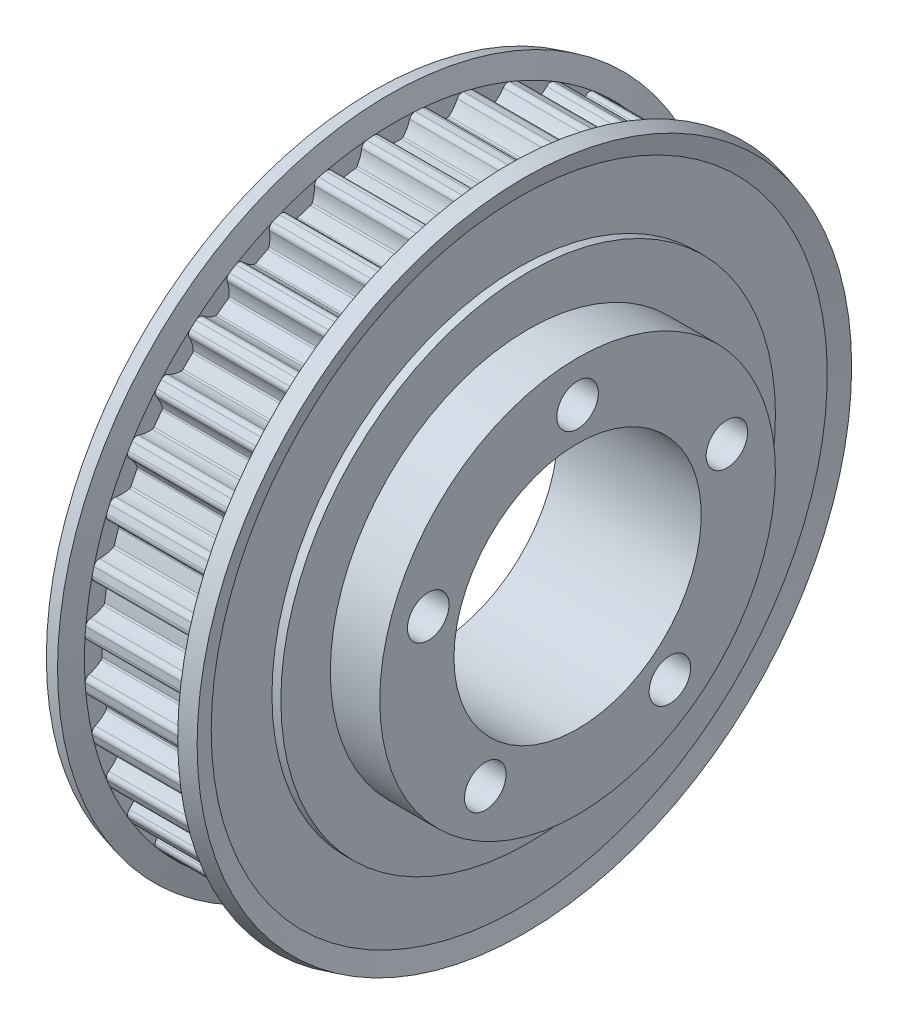
from build123d import *

# Parameters (mm, degrees)
SKETCH2_W             = 21
SKETCH2_H             = 12.5
CUT_EXTRUDE1_DEPTH    = 11
CUT_EXTRUDE2_DEPTH    = 11
CUT_EXTRUDE3_DEPTH    = 11
CUT_EXTRUDE4_DEPTH    = 11
CUT_EXTRUDE5_DEPTH    = 11
CUT_EXTRUDE6_DEPTH    = 11
CUT_EXTRUDE7_DEPTH    = 11
CUT_EXTRUDE8_DEPTH    = 11
CUT_EXTRUDE9_DEPTH    = 11
CUT_EXTRUDE10_DEPTH   = 11
CUT_EXTRUDE11_DEPTH   = 11
CUT_EXTRUDE12_DEPTH   = 11
CUT_EXTRUDE13_DEPTH   = 11
CUT_EXTRUDE14_DEPTH   = 11
CUT_EXTRUDE15_DEPTH   = 11
CUT_EXTRUDE16_DEPTH   = 11
CUT_EXTRUDE17_DEPTH   = 11
CUT_EXTRUDE18_DEPTH   = 11
CUT_EXTRUDE19_DEPTH   = 11
CUT_EXTRUDE20_DEPTH   = 11
CUT_EXTRUDE21_DEPTH   = 11
CUT_EXTRUDE22_DEPTH   = 11
CUT_EXTRUDE23_DEPTH   = 11
CUT_EXTRUDE24_DEPTH   = 11
CUT_EXTRUDE25_DEPTH   = 11
CUT_EXTRUDE26_DEPTH   = 11
CUT_EXTRUDE27_DEPTH   = 11
CUT_EXTRUDE28_DEPTH   = 11
CUT_EXTRUDE29_DEPTH   = 11
CUT_EXTRUDE30_DEPTH   = 11
CUT_EXTRUDE31_DEPTH   = 11
CUT_EXTRUDE32_DEPTH   = 11
CUT_EXTRUDE33_DEPTH   = 11
CUT_EXTRUDE34_DEPTH   = 11
CUT_EXTRUDE35_DEPTH   = 11
CUT_EXTRUDE36_DEPTH   = 11
CUT_EXTRUDE37_DEPTH   = 11
CUT_EXTRUDE38_DEPTH   = 11
CUT_EXTRUDE39_DEPTH   = 11
CUT_EXTRUDE40_DEPTH   = 11
SKETCH43_W            = 5
SKETCH43_H            = 3.5
M5X0_8_TAPPED_HOLE1_D = 4.2
CIRPATTERN1_COUNT     = 5
SKETCH47_R            = 23.5
CUT_EXTRUDE41_DEPTH   = 6.5


with BuildPart() as part:
    # Sketch1 → Revolve1 (revolve)
    with BuildSketch(Plane.XY):
        Polygon((0, 0), (0, 25), (0.9, 25), (0.9, 31.139356004), (0.378427914, 33.085889528), (1.923909236, 33.5), (2.5, 31.35), (13.5, 31.35), (14.076090764, 33.5), (15.621572086, 33.085889528), (15.1, 31.139356004), (15.1, 25), (16, 25), (16, 23.5), (21, 23.5), (21, 0), align=None)
    revolve(axis=Axis((21, 0, 0), (-1, 0, 0)))

    # Sketch2 → Cut-Revolve1 (revolve, cut)
    with BuildSketch(Plane.XY):
        with Locations((10.5, 6.25)):
            Rectangle(SKETCH2_W, SKETCH2_H)
    revolve(axis=Axis((21, 0, 0), (-1, 0, 0)), mode=Mode.SUBTRACT)

    # Sketch3 → Cut-Extrude1 (cut)
    with BuildSketch(Plane(origin=(2.5, 0, 0), x_dir=(0, 0, -1), z_dir=(1, 0, 0))):
        with BuildLine():
            Line((2.087720208, 31.280407995), (2.087720208, 31.761459732))
            ThreePointArc((2.087720208, 31.761459732), (0, 31.83), (-2.087720208, 31.761459732))
            Line((-2.087720208, 31.761459732), (-2.087720208, 31.280407995))
            ThreePointArc((-2.087720208, 31.280407995), (-1.735068973, 31.181771634), (-1.522504924, 30.883596266))
            ThreePointArc((-1.522504924, 30.883596266), (-1.258864332, 30.23641307), (-0.863917433, 29.659898198))
            ThreePointArc((-0.863917433, 29.659898198), (-0.775941477, 29.594148784), (-0.668275681, 29.572450146))
            ThreePointArc((-0.668275681, 29.572450146), (9e-09, 29.58), (0.668275699, 29.572450145))
            ThreePointArc((0.668275699, 29.572450145), (0.775941485, 29.594148787), (0.863917433, 29.659898198))
            ThreePointArc((0.863917433, 29.659898198), (1.258864332, 30.23641307), (1.522504924, 30.883596266))
            ThreePointArc((1.522504924, 30.883596266), (1.735068973, 31.181771634), (2.087720208, 31.280407995))
        make_face()
    extrude(amount=CUT_EXTRUDE1_DEPTH, mode=Mode.SUBTRACT)

    # Sketch4 → Cut-Extrude2 (cut)
    with BuildSketch(Plane(origin=(2.5, 0, 0), x_dir=(0, 0, -1), z_dir=(1, 0, 0))):
        with BuildLine():
            Line((6.955350799, 30.568702872), (7.03060387, 31.043832064))
            ThreePointArc((7.03060387, 31.043832064), (4.979309022, 31.438119881), (2.906570055, 31.697014852))
            Line((2.906570055, 31.697014852), (2.831316983, 31.22188566))
            ThreePointArc((2.831316983, 31.22188566), (3.16419637, 31.069296869), (3.327498498, 30.741540191))
            ThreePointArc((3.327498498, 30.741540191), (3.48665148, 30.061082419), (3.786549132, 29.429882095))
            ThreePointArc((3.786549132, 29.429882095), (3.863156484, 29.351179693), (3.96610232, 29.31290556))
            ThreePointArc((3.96610232, 29.31290556), (4.627331485, 29.215821113), (5.286198535, 29.10382286))
            ThreePointArc((5.286198535, 29.10382286), (5.395933191, 29.108411716), (5.493111483, 29.159589172))
            ThreePointArc((5.493111483, 29.159589172), (5.973382727, 29.667222882), (6.335019222, 30.265195704))
            ThreePointArc((6.335019222, 30.265195704), (6.591611159, 30.526447696), (6.955350799, 30.568702872))
        make_face()
    extrude(amount=CUT_EXTRUDE2_DEPTH, mode=Mode.SUBTRACT)

    # Sketch5 → Cut-Extrude3 (cut)
    with BuildSketch(Plane(origin=(2.5, 0, 0), x_dir=(0, 0, -1), z_dir=(1, 0, 0))):
        with BuildLine():
            Line((11.651717569, 29.104294832), (11.800370731, 29.561802222))
            ThreePointArc((11.800370731, 29.561802222), (9.836010931, 30.272128914), (7.829290916, 30.852084269))
            Line((7.829290916, 30.852084269), (7.680637754, 30.39457688))
            ThreePointArc((7.680637754, 30.39457688), (7.985548697, 30.191792901), (8.095567864, 29.842525371))
            ThreePointArc((8.095567864, 29.842525371), (8.146314361, 29.145548152), (8.343778291, 28.475204623))
            ThreePointArc((8.343778291, 28.475204623), (8.407130711, 28.385487148), (8.502821719, 28.331579956))
            ThreePointArc((8.502821719, 28.331579956), (9.140722702, 28.132251749), (9.773957618, 27.918562865))
            ThreePointArc((9.773957618, 27.918562865), (9.883059115, 27.905928943), (9.987046899, 27.941274286))
            ThreePointArc((9.987046899, 27.941274286), (10.540816614, 28.367527207), (10.991544323, 28.901565579))
            ThreePointArc((10.991544323, 28.901565579), (11.285846002, 29.119461303), (11.651717569, 29.104294832))
        make_face()
    extrude(amount=CUT_EXTRUDE3_DEPTH, mode=Mode.SUBTRACT)

    # Sketch6 → Cut-Extrude4 (cut)
    with BuildSketch(Plane(origin=(2.5, 0, 0), x_dir=(0, 0, -1), z_dir=(1, 0, 0))):
        with BuildLine():
            Line((16.061180383, 26.923242462), (16.279573302, 27.351862699))
            ThreePointArc((16.279573302, 27.351862699), (14.450517607, 28.360737665), (12.559228651, 29.24747298))
            Line((12.559228651, 29.24747298), (12.340835732, 28.818852743))
            ThreePointArc((12.340835732, 28.818852743), (12.610270312, 28.570866792), (12.664297482, 28.208688534))
            ThreePointArc((12.664297482, 28.208688534), (12.605387947, 27.512353761), (12.695555936, 26.819373109))
            ThreePointArc((12.695555936, 26.819373109), (12.744093478, 26.720849703), (12.830173428, 26.652636826))
            ThreePointArc((12.830173428, 26.652636826), (13.42903899, 26.355972981), (14.021049428, 26.045855197))
            ThreePointArc((14.021049428, 26.045855197), (14.126831323, 26.016309585), (14.235068074, 26.034952494))
            ThreePointArc((14.235068074, 26.034952494), (14.848700613, 26.369328866), (15.377421123, 26.826282992))
            ThreePointArc((15.377421123, 26.826282992), (15.702185862, 26.995457132), (16.061180383, 26.923242462))
        make_face()
    extrude(amount=CUT_EXTRUDE4_DEPTH, mode=Mode.SUBTRACT)

    # Sketch7 → Cut-Extrude5 (cut)
    with BuildSketch(Plane(origin=(2.5, 0, 0), x_dir=(0, 0, -1), z_dir=(1, 0, 0))):
        with BuildLine():
            Line((20.075163633, 24.07925051), (20.35791875, 24.468429541))
            ThreePointArc((20.35791875, 24.468429541), (18.70920458, 25.751010931), (16.979916494, 26.922691839))
            Line((16.979916494, 26.922691839), (16.697161378, 26.533512808))
            ThreePointArc((16.697161378, 26.533512808), (16.924485222, 26.246431121), (16.921190065, 25.880260167))
            ThreePointArc((16.921190065, 25.880260167), (16.754075046, 25.201713912), (16.73472686, 24.50315962))
            ThreePointArc((16.73472686, 24.50315962), (16.767254368, 24.398256257), (16.841603687, 24.317417323))
            ThreePointArc((16.841603687, 24.317417323), (17.38668777, 23.930722688), (17.922896467, 23.531812132))
            ThreePointArc((17.922896467, 23.531812132), (18.022754059, 23.486082341), (18.13257463, 23.487563768))
            ThreePointArc((18.13257463, 23.487563768), (18.790960323, 23.721830133), (19.38465478, 24.090448285))
            ThreePointArc((19.38465478, 24.090448285), (19.731885792, 24.206735213), (20.075163633, 24.07925051))
        make_face()
    extrude(amount=CUT_EXTRUDE5_DEPTH, mode=Mode.SUBTRACT)

    # Sketch8 → Cut-Extrude6 (cut)
    with BuildSketch(Plane(origin=(2.5, 0, 0), x_dir=(0, 0, -1), z_dir=(1, 0, 0))):
        with BuildLine():
            Line((23.594829728, 20.642347495), (23.934984673, 20.982502441))
            ThreePointArc((23.934984673, 20.982502441), (22.507208845, 22.507208845), (20.982502441, 23.934984673))
            Line((20.982502441, 23.934984673), (20.642347495, 23.594829728))
            ThreePointArc((20.642347495, 23.594829728), (20.821963136, 23.275721208), (20.761426791, 22.914573903))
            ThreePointArc((20.761426791, 22.914573903), (20.490221215, 22.270524226), (20.36183327, 21.58359702))
            ThreePointArc((20.36183327, 21.58359702), (20.377549808, 21.474896768), (20.438337768, 21.3834223))
            ThreePointArc((20.438337768, 21.3834223), (20.916218594, 20.916218581), (21.383422312, 20.438337755))
            ThreePointArc((21.383422312, 20.438337755), (21.474896777, 20.377549805), (21.58359702, 20.36183327))
            ThreePointArc((21.58359702, 20.36183327), (22.270524226, 20.490221215), (22.914573903, 20.761426791))
            ThreePointArc((22.914573903, 20.761426791), (23.275721208, 20.821963136), (23.594829728, 20.642347495))
        make_face()
    extrude(amount=CUT_EXTRUDE6_DEPTH, mode=Mode.SUBTRACT)

    # Sketch9 → Cut-Extrude7 (cut)
    with BuildSketch(Plane(origin=(2.5, 0, 0), x_dir=(0, 0, -1), z_dir=(1, 0, 0))):
        with BuildLine():
            Line((26.533512808, 16.697161378), (26.922691839, 16.979916494))
            ThreePointArc((26.922691839, 16.979916494), (25.751010931, 18.70920458), (24.468429541, 20.35791875))
            Line((24.468429541, 20.35791875), (24.07925051, 20.075163633))
            ThreePointArc((24.07925051, 20.075163633), (24.206735213, 19.731885792), (24.090448285, 19.38465478))
            ThreePointArc((24.090448285, 19.38465478), (23.721830133, 18.790960323), (23.487563768, 18.13257463))
            ThreePointArc((23.487563768, 18.13257463), (23.486082343, 18.02275405), (23.531812143, 17.922896453))
            ThreePointArc((23.531812143, 17.922896453), (23.930722699, 17.386687756), (24.317417333, 16.841603672))
            ThreePointArc((24.317417333, 16.841603672), (24.398256264, 16.767254363), (24.50315962, 16.73472686))
            ThreePointArc((24.50315962, 16.73472686), (25.201713912, 16.754075046), (25.880260167, 16.921190065))
            ThreePointArc((25.880260167, 16.921190065), (26.246431121, 16.924485222), (26.533512808, 16.697161378))
        make_face()
    extrude(amount=CUT_EXTRUDE7_DEPTH, mode=Mode.SUBTRACT)

    # Sketch10 → Cut-Extrude8 (cut)
    with BuildSketch(Plane(origin=(2.5, 0, 0), x_dir=(0, 0, -1), z_dir=(1, 0, 0))):
        with BuildLine():
            Line((28.818852743, 12.340835732), (29.24747298, 12.559228651))
            ThreePointArc((29.24747298, 12.559228651), (28.360737665, 14.450517607), (27.351862699, 16.279573302))
            Line((27.351862699, 16.279573302), (26.923242462, 16.061180383))
            ThreePointArc((26.923242462, 16.061180383), (26.995457132, 15.702185862), (26.826282992, 15.377421123))
            ThreePointArc((26.826282992, 15.377421123), (26.369328866, 14.848700613), (26.034952494, 14.235068074))
            ThreePointArc((26.034952494, 14.235068074), (26.016309585, 14.126831314), (26.045855205, 14.021049412))
            ThreePointArc((26.045855205, 14.021049412), (26.35597299, 13.429038974), (26.652636834, 12.830173412))
            ThreePointArc((26.652636834, 12.830173412), (26.72084971, 12.744093472), (26.819373109, 12.695555936))
            ThreePointArc((26.819373109, 12.695555936), (27.512353761, 12.605387947), (28.208688534, 12.664297482))
            ThreePointArc((28.208688534, 12.664297482), (28.570866792, 12.610270312), (28.818852743, 12.340835732))
        make_face()
    extrude(amount=CUT_EXTRUDE8_DEPTH, mode=Mode.SUBTRACT)

    # Sketch11 → Cut-Extrude9 (cut)
    with BuildSketch(Plane(origin=(2.5, 0, 0), x_dir=(0, 0, -1), z_dir=(1, 0, 0))):
        with BuildLine():
            Line((30.39457688, 7.680637754), (30.852084269, 7.829290916))
            ThreePointArc((30.852084269, 7.829290916), (30.272128914, 9.836010931), (29.561802222, 11.800370731))
            Line((29.561802222, 11.800370731), (29.104294832, 11.651717569))
            ThreePointArc((29.104294832, 11.651717569), (29.119461303, 11.285846002), (28.901565579, 10.991544323))
            ThreePointArc((28.901565579, 10.991544323), (28.367527207, 10.540816614), (27.941274286, 9.987046899))
            ThreePointArc((27.941274286, 9.987046899), (27.905928942, 9.883059106), (27.918562871, 9.773957602))
            ThreePointArc((27.918562871, 9.773957602), (28.132251755, 9.140722685), (28.331579961, 8.502821702))
            ThreePointArc((28.331579961, 8.502821702), (28.385487154, 8.407130704), (28.475204623, 8.343778291))
            ThreePointArc((28.475204623, 8.343778291), (29.145548152, 8.146314361), (29.842525371, 8.095567864))
            ThreePointArc((29.842525371, 8.095567864), (30.191792901, 7.985548697), (30.39457688, 7.680637754))
        make_face()
    extrude(amount=CUT_EXTRUDE9_DEPTH, mode=Mode.SUBTRACT)

    # Sketch12 → Cut-Extrude10 (cut)
    with BuildSketch(Plane(origin=(2.5, 0, 0), x_dir=(0, 0, -1), z_dir=(1, 0, 0))):
        with BuildLine():
            Line((31.22188566, 2.831316983), (31.697014852, 2.906570055))
            ThreePointArc((31.697014852, 2.906570055), (31.438119881, 4.979309022), (31.043832064, 7.03060387))
            Line((31.043832064, 7.03060387), (30.568702872, 6.955350799))
            ThreePointArc((30.568702872, 6.955350799), (30.526447696, 6.591611159), (30.265195704, 6.335019222))
            ThreePointArc((30.265195704, 6.335019222), (29.667222882, 5.973382727), (29.159589172, 5.493111483))
            ThreePointArc((29.159589172, 5.493111483), (29.108411714, 5.395933183), (29.103822863, 5.286198517))
            ThreePointArc((29.103822863, 5.286198517), (29.215821116, 4.627331467), (29.312905563, 3.966102302))
            ThreePointArc((29.312905563, 3.966102302), (29.351179698, 3.863156476), (29.429882095, 3.786549132))
            ThreePointArc((29.429882095, 3.786549132), (30.061082419, 3.48665148), (30.741540191, 3.327498498))
            ThreePointArc((30.741540191, 3.327498498), (31.069296869, 3.16419637), (31.22188566, 2.831316983))
        make_face()
    extrude(amount=CUT_EXTRUDE10_DEPTH, mode=Mode.SUBTRACT)

    # Sketch13 → Cut-Extrude11 (cut)
    with BuildSketch(Plane(origin=(2.5, 0, 0), x_dir=(0, 0, -1), z_dir=(1, 0, 0))):
        with BuildLine():
            Line((31.280407995, -2.087720208), (31.761459732, -2.087720208))
            ThreePointArc((31.761459732, -2.087720208), (31.83, 0), (31.761459732, 2.087720208))
            Line((31.761459732, 2.087720208), (31.280407995, 2.087720208))
            ThreePointArc((31.280407995, 2.087720208), (31.181771634, 1.735068973), (30.883596266, 1.522504924))
            ThreePointArc((30.883596266, 1.522504924), (30.23641307, 1.258864332), (29.659898198, 0.863917433))
            ThreePointArc((29.659898198, 0.863917433), (29.594148784, 0.775941477), (29.572450146, 0.668275681))
            ThreePointArc((29.572450146, 0.668275681), (29.58, -9e-09), (29.572450145, -0.668275699))
            ThreePointArc((29.572450145, -0.668275699), (29.594148787, -0.775941485), (29.659898198, -0.863917433))
            ThreePointArc((29.659898198, -0.863917433), (30.23641307, -1.258864332), (30.883596266, -1.522504924))
            ThreePointArc((30.883596266, -1.522504924), (31.181771634, -1.735068973), (31.280407995, -2.087720208))
        make_face()
    extrude(amount=CUT_EXTRUDE11_DEPTH, mode=Mode.SUBTRACT)

    # Sketch14 → Cut-Extrude12 (cut)
    with BuildSketch(Plane(origin=(2.5, 0, 0), x_dir=(0, 0, -1), z_dir=(1, 0, 0))):
        with BuildLine():
            Line((30.568702872, -6.955350799), (31.043832064, -7.03060387))
            ThreePointArc((31.043832064, -7.03060387), (31.438119881, -4.979309022), (31.697014852, -2.906570055))
            Line((31.697014852, -2.906570055), (31.22188566, -2.831316983))
            ThreePointArc((31.22188566, -2.831316983), (31.069296869, -3.16419637), (30.741540191, -3.327498498))
            ThreePointArc((30.741540191, -3.327498498), (30.061082419, -3.48665148), (29.429882095, -3.786549132))
            ThreePointArc((29.429882095, -3.786549132), (29.351179693, -3.863156484), (29.31290556, -3.96610232))
            ThreePointArc((29.31290556, -3.96610232), (29.215821113, -4.627331485), (29.10382286, -5.286198535))
            ThreePointArc((29.10382286, -5.286198535), (29.108411716, -5.395933191), (29.159589172, -5.493111483))
            ThreePointArc((29.159589172, -5.493111483), (29.667222882, -5.973382727), (30.265195704, -6.335019222))
            ThreePointArc((30.265195704, -6.335019222), (30.526447696, -6.591611159), (30.568702872, -6.955350799))
        make_face()
    extrude(amount=CUT_EXTRUDE12_DEPTH, mode=Mode.SUBTRACT)

    # Sketch15 → Cut-Extrude13 (cut)
    with BuildSketch(Plane(origin=(2.5, 0, 0), x_dir=(0, 0, -1), z_dir=(1, 0, 0))):
        with BuildLine():
            Line((29.104294832, -11.651717569), (29.561802222, -11.800370731))
            ThreePointArc((29.561802222, -11.800370731), (30.272128914, -9.836010931), (30.852084269, -7.829290916))
            Line((30.852084269, -7.829290916), (30.39457688, -7.680637754))
            ThreePointArc((30.39457688, -7.680637754), (30.191792901, -7.985548697), (29.842525371, -8.095567864))
            ThreePointArc((29.842525371, -8.095567864), (29.145548152, -8.146314361), (28.475204623, -8.343778291))
            ThreePointArc((28.475204623, -8.343778291), (28.385487148, -8.407130711), (28.331579956, -8.502821719))
            ThreePointArc((28.331579956, -8.502821719), (28.132251749, -9.140722702), (27.918562865, -9.773957618))
            ThreePointArc((27.918562865, -9.773957618), (27.905928943, -9.883059115), (27.941274286, -9.987046899))
            ThreePointArc((27.941274286, -9.987046899), (28.367527207, -10.540816614), (28.901565579, -10.991544323))
            ThreePointArc((28.901565579, -10.991544323), (29.119461303, -11.285846002), (29.104294832, -11.651717569))
        make_face()
    extrude(amount=CUT_EXTRUDE13_DEPTH, mode=Mode.SUBTRACT)

    # Sketch16 → Cut-Extrude14 (cut)
    with BuildSketch(Plane(origin=(2.5, 0, 0), x_dir=(0, 0, -1), z_dir=(1, 0, 0))):
        with BuildLine():
            Line((26.923242462, -16.061180383), (27.351862699, -16.279573302))
            ThreePointArc((27.351862699, -16.279573302), (28.360737665, -14.450517607), (29.24747298, -12.559228651))
            Line((29.24747298, -12.559228651), (28.818852743, -12.340835732))
            ThreePointArc((28.818852743, -12.340835732), (28.570866792, -12.610270312), (28.208688534, -12.664297482))
            ThreePointArc((28.208688534, -12.664297482), (27.512353761, -12.605387947), (26.819373109, -12.695555936))
            ThreePointArc((26.819373109, -12.695555936), (26.720849703, -12.744093478), (26.652636826, -12.830173428))
            ThreePointArc((26.652636826, -12.830173428), (26.355972981, -13.42903899), (26.045855197, -14.021049428))
            ThreePointArc((26.045855197, -14.021049428), (26.016309585, -14.126831323), (26.034952494, -14.235068074))
            ThreePointArc((26.034952494, -14.235068074), (26.369328866, -14.848700613), (26.826282992, -15.377421123))
            ThreePointArc((26.826282992, -15.377421123), (26.995457132, -15.702185862), (26.923242462, -16.061180383))
        make_face()
    extrude(amount=CUT_EXTRUDE14_DEPTH, mode=Mode.SUBTRACT)

    # Sketch17 → Cut-Extrude15 (cut)
    with BuildSketch(Plane(origin=(2.5, 0, 0), x_dir=(0, 0, -1), z_dir=(1, 0, 0))):
        with BuildLine():
            Line((24.07925051, -20.075163633), (24.468429541, -20.35791875))
            ThreePointArc((24.468429541, -20.35791875), (25.751010931, -18.70920458), (26.922691839, -16.979916494))
            Line((26.922691839, -16.979916494), (26.533512808, -16.697161378))
            ThreePointArc((26.533512808, -16.697161378), (26.246431121, -16.924485222), (25.880260167, -16.921190065))
            ThreePointArc((25.880260167, -16.921190065), (25.201713912, -16.754075046), (24.50315962, -16.73472686))
            ThreePointArc((24.50315962, -16.73472686), (24.398256257, -16.767254368), (24.317417323, -16.841603687))
            ThreePointArc((24.317417323, -16.841603687), (23.930722688, -17.38668777), (23.531812132, -17.922896467))
            ThreePointArc((23.531812132, -17.922896467), (23.486082341, -18.022754059), (23.487563768, -18.13257463))
            ThreePointArc((23.487563768, -18.13257463), (23.721830133, -18.790960323), (24.090448285, -19.38465478))
            ThreePointArc((24.090448285, -19.38465478), (24.206735213, -19.731885792), (24.07925051, -20.075163633))
        make_face()
    extrude(amount=CUT_EXTRUDE15_DEPTH, mode=Mode.SUBTRACT)

    # Sketch18 → Cut-Extrude16 (cut)
    with BuildSketch(Plane(origin=(2.5, 0, 0), x_dir=(0, 0, -1), z_dir=(1, 0, 0))):
        with BuildLine():
            Line((20.642347495, -23.594829728), (20.982502441, -23.934984673))
            ThreePointArc((20.982502441, -23.934984673), (22.507208845, -22.507208845), (23.934984673, -20.982502441))
            Line((23.934984673, -20.982502441), (23.594829728, -20.642347495))
            ThreePointArc((23.594829728, -20.642347495), (23.275721208, -20.821963136), (22.914573903, -20.761426791))
            ThreePointArc((22.914573903, -20.761426791), (22.270524226, -20.490221215), (21.58359702, -20.36183327))
            ThreePointArc((21.58359702, -20.36183327), (21.474896768, -20.377549808), (21.3834223, -20.438337768))
            ThreePointArc((21.3834223, -20.438337768), (20.916218581, -20.916218594), (20.438337755, -21.383422312))
            ThreePointArc((20.438337755, -21.383422312), (20.377549805, -21.474896777), (20.36183327, -21.58359702))
            ThreePointArc((20.36183327, -21.58359702), (20.490221215, -22.270524226), (20.761426791, -22.914573903))
            ThreePointArc((20.761426791, -22.914573903), (20.821963136, -23.275721208), (20.642347495, -23.594829728))
        make_face()
    extrude(amount=CUT_EXTRUDE16_DEPTH, mode=Mode.SUBTRACT)

    # Sketch19 → Cut-Extrude17 (cut)
    with BuildSketch(Plane(origin=(2.5, 0, 0), x_dir=(0, 0, -1), z_dir=(1, 0, 0))):
        with BuildLine():
            Line((16.697161378, -26.533512808), (16.979916494, -26.922691839))
            ThreePointArc((16.979916494, -26.922691839), (18.70920458, -25.751010931), (20.35791875, -24.468429541))
            Line((20.35791875, -24.468429541), (20.075163633, -24.07925051))
            ThreePointArc((20.075163633, -24.07925051), (19.731885792, -24.206735213), (19.38465478, -24.090448285))
            ThreePointArc((19.38465478, -24.090448285), (18.790960323, -23.721830133), (18.13257463, -23.487563768))
            ThreePointArc((18.13257463, -23.487563768), (18.02275405, -23.486082343), (17.922896453, -23.531812143))
            ThreePointArc((17.922896453, -23.531812143), (17.386687756, -23.930722699), (16.841603672, -24.317417333))
            ThreePointArc((16.841603672, -24.317417333), (16.767254363, -24.398256264), (16.73472686, -24.50315962))
            ThreePointArc((16.73472686, -24.50315962), (16.754075046, -25.201713912), (16.921190065, -25.880260167))
            ThreePointArc((16.921190065, -25.880260167), (16.924485222, -26.246431121), (16.697161378, -26.533512808))
        make_face()
    extrude(amount=CUT_EXTRUDE17_DEPTH, mode=Mode.SUBTRACT)

    # Sketch20 → Cut-Extrude18 (cut)
    with BuildSketch(Plane(origin=(2.5, 0, 0), x_dir=(0, 0, -1), z_dir=(1, 0, 0))):
        with BuildLine():
            Line((12.340835732, -28.818852743), (12.559228651, -29.24747298))
            ThreePointArc((12.559228651, -29.24747298), (14.450517607, -28.360737665), (16.279573302, -27.351862699))
            Line((16.279573302, -27.351862699), (16.061180383, -26.923242462))
            ThreePointArc((16.061180383, -26.923242462), (15.702185862, -26.995457132), (15.377421123, -26.826282992))
            ThreePointArc((15.377421123, -26.826282992), (14.848700613, -26.369328866), (14.235068074, -26.034952494))
            ThreePointArc((14.235068074, -26.034952494), (14.126831314, -26.016309585), (14.021049412, -26.045855205))
            ThreePointArc((14.021049412, -26.045855205), (13.429038974, -26.35597299), (12.830173412, -26.652636834))
            ThreePointArc((12.830173412, -26.652636834), (12.744093472, -26.72084971), (12.695555936, -26.819373109))
            ThreePointArc((12.695555936, -26.819373109), (12.605387947, -27.512353761), (12.664297482, -28.208688534))
            ThreePointArc((12.664297482, -28.208688534), (12.610270312, -28.570866792), (12.340835732, -28.818852743))
        make_face()
    extrude(amount=CUT_EXTRUDE18_DEPTH, mode=Mode.SUBTRACT)

    # Sketch21 → Cut-Extrude19 (cut)
    with BuildSketch(Plane(origin=(2.5, 0, 0), x_dir=(0, 0, -1), z_dir=(1, 0, 0))):
        with BuildLine():
            Line((7.680637754, -30.39457688), (7.829290916, -30.852084269))
            ThreePointArc((7.829290916, -30.852084269), (9.836010931, -30.272128914), (11.800370731, -29.561802222))
            Line((11.800370731, -29.561802222), (11.651717569, -29.104294832))
            ThreePointArc((11.651717569, -29.104294832), (11.285846002, -29.119461303), (10.991544323, -28.901565579))
            ThreePointArc((10.991544323, -28.901565579), (10.540816614, -28.367527207), (9.987046899, -27.941274286))
            ThreePointArc((9.987046899, -27.941274286), (9.883059106, -27.905928942), (9.773957602, -27.918562871))
            ThreePointArc((9.773957602, -27.918562871), (9.140722685, -28.132251755), (8.502821702, -28.331579961))
            ThreePointArc((8.502821702, -28.331579961), (8.407130704, -28.385487154), (8.343778291, -28.475204623))
            ThreePointArc((8.343778291, -28.475204623), (8.146314361, -29.145548152), (8.095567864, -29.842525371))
            ThreePointArc((8.095567864, -29.842525371), (7.985548697, -30.191792901), (7.680637754, -30.39457688))
        make_face()
    extrude(amount=CUT_EXTRUDE19_DEPTH, mode=Mode.SUBTRACT)

    # Sketch22 → Cut-Extrude20 (cut)
    with BuildSketch(Plane(origin=(2.5, 0, 0), x_dir=(0, 0, -1), z_dir=(1, 0, 0))):
        with BuildLine():
            Line((2.831316983, -31.22188566), (2.906570055, -31.697014852))
            ThreePointArc((2.906570055, -31.697014852), (4.979309022, -31.438119881), (7.03060387, -31.043832064))
            Line((7.03060387, -31.043832064), (6.955350799, -30.568702872))
            ThreePointArc((6.955350799, -30.568702872), (6.591611159, -30.526447696), (6.335019222, -30.265195704))
            ThreePointArc((6.335019222, -30.265195704), (5.973382727, -29.667222882), (5.493111483, -29.159589172))
            ThreePointArc((5.493111483, -29.159589172), (5.395933183, -29.108411714), (5.286198517, -29.103822863))
            ThreePointArc((5.286198517, -29.103822863), (4.627331467, -29.215821116), (3.966102302, -29.312905563))
            ThreePointArc((3.966102302, -29.312905563), (3.863156476, -29.351179698), (3.786549132, -29.429882095))
            ThreePointArc((3.786549132, -29.429882095), (3.48665148, -30.061082419), (3.327498498, -30.741540191))
            ThreePointArc((3.327498498, -30.741540191), (3.16419637, -31.069296869), (2.831316983, -31.22188566))
        make_face()
    extrude(amount=CUT_EXTRUDE20_DEPTH, mode=Mode.SUBTRACT)

    # Sketch23 → Cut-Extrude21 (cut)
    with BuildSketch(Plane(origin=(2.5, 0, 0), x_dir=(0, 0, -1), z_dir=(1, 0, 0))):
        with BuildLine():
            Line((-2.087720208, -31.280407995), (-2.087720208, -31.761459732))
            ThreePointArc((-2.087720208, -31.761459732), (0, -31.83), (2.087720208, -31.761459732))
            Line((2.087720208, -31.761459732), (2.087720208, -31.280407995))
            ThreePointArc((2.087720208, -31.280407995), (1.735068973, -31.181771634), (1.522504924, -30.883596266))
            ThreePointArc((1.522504924, -30.883596266), (1.258864332, -30.23641307), (0.863917433, -29.659898198))
            ThreePointArc((0.863917433, -29.659898198), (0.775941477, -29.594148784), (0.668275681, -29.572450146))
            ThreePointArc((0.668275681, -29.572450146), (-9e-09, -29.58), (-0.668275699, -29.572450145))
            ThreePointArc((-0.668275699, -29.572450145), (-0.775941485, -29.594148787), (-0.863917433, -29.659898198))
            ThreePointArc((-0.863917433, -29.659898198), (-1.258864332, -30.23641307), (-1.522504924, -30.883596266))
            ThreePointArc((-1.522504924, -30.883596266), (-1.735068973, -31.181771634), (-2.087720208, -31.280407995))
        make_face()
    extrude(amount=CUT_EXTRUDE21_DEPTH, mode=Mode.SUBTRACT)

    # Sketch24 → Cut-Extrude22 (cut)
    with BuildSketch(Plane(origin=(2.5, 0, 0), x_dir=(0, 0, -1), z_dir=(1, 0, 0))):
        with BuildLine():
            Line((-6.955350799, -30.568702872), (-7.03060387, -31.043832064))
            ThreePointArc((-7.03060387, -31.043832064), (-4.979309022, -31.438119881), (-2.906570055, -31.697014852))
            Line((-2.906570055, -31.697014852), (-2.831316983, -31.22188566))
            ThreePointArc((-2.831316983, -31.22188566), (-3.16419637, -31.069296869), (-3.327498498, -30.741540191))
            ThreePointArc((-3.327498498, -30.741540191), (-3.48665148, -30.061082419), (-3.786549132, -29.429882095))
            ThreePointArc((-3.786549132, -29.429882095), (-3.863156484, -29.351179693), (-3.96610232, -29.31290556))
            ThreePointArc((-3.96610232, -29.31290556), (-4.627331485, -29.215821113), (-5.286198535, -29.10382286))
            ThreePointArc((-5.286198535, -29.10382286), (-5.395933191, -29.108411716), (-5.493111483, -29.159589172))
            ThreePointArc((-5.493111483, -29.159589172), (-5.973382727, -29.667222882), (-6.335019222, -30.265195704))
            ThreePointArc((-6.335019222, -30.265195704), (-6.591611159, -30.526447696), (-6.955350799, -30.568702872))
        make_face()
    extrude(amount=CUT_EXTRUDE22_DEPTH, mode=Mode.SUBTRACT)

    # Sketch25 → Cut-Extrude23 (cut)
    with BuildSketch(Plane(origin=(2.5, 0, 0), x_dir=(0, 0, -1), z_dir=(1, 0, 0))):
        with BuildLine():
            Line((-11.651717569, -29.104294832), (-11.800370731, -29.561802222))
            ThreePointArc((-11.800370731, -29.561802222), (-9.836010931, -30.272128914), (-7.829290916, -30.852084269))
            Line((-7.829290916, -30.852084269), (-7.680637754, -30.39457688))
            ThreePointArc((-7.680637754, -30.39457688), (-7.985548697, -30.191792901), (-8.095567864, -29.842525371))
            ThreePointArc((-8.095567864, -29.842525371), (-8.146314361, -29.145548152), (-8.343778291, -28.475204623))
            ThreePointArc((-8.343778291, -28.475204623), (-8.407130711, -28.385487148), (-8.502821719, -28.331579956))
            ThreePointArc((-8.502821719, -28.331579956), (-9.140722702, -28.132251749), (-9.773957618, -27.918562865))
            ThreePointArc((-9.773957618, -27.918562865), (-9.883059115, -27.905928943), (-9.987046899, -27.941274286))
            ThreePointArc((-9.987046899, -27.941274286), (-10.540816614, -28.367527207), (-10.991544323, -28.901565579))
            ThreePointArc((-10.991544323, -28.901565579), (-11.285846002, -29.119461303), (-11.651717569, -29.104294832))
        make_face()
    extrude(amount=CUT_EXTRUDE23_DEPTH, mode=Mode.SUBTRACT)

    # Sketch26 → Cut-Extrude24 (cut)
    with BuildSketch(Plane(origin=(2.5, 0, 0), x_dir=(0, 0, -1), z_dir=(1, 0, 0))):
        with BuildLine():
            Line((-16.061180383, -26.923242462), (-16.279573302, -27.351862699))
            ThreePointArc((-16.279573302, -27.351862699), (-14.450517607, -28.360737665), (-12.559228651, -29.24747298))
            Line((-12.559228651, -29.24747298), (-12.340835732, -28.818852743))
            ThreePointArc((-12.340835732, -28.818852743), (-12.610270312, -28.570866792), (-12.664297482, -28.208688534))
            ThreePointArc((-12.664297482, -28.208688534), (-12.605387947, -27.512353761), (-12.695555936, -26.819373109))
            ThreePointArc((-12.695555936, -26.819373109), (-12.744093478, -26.720849703), (-12.830173428, -26.652636826))
            ThreePointArc((-12.830173428, -26.652636826), (-13.42903899, -26.355972981), (-14.021049428, -26.045855197))
            ThreePointArc((-14.021049428, -26.045855197), (-14.126831323, -26.016309585), (-14.235068074, -26.034952494))
            ThreePointArc((-14.235068074, -26.034952494), (-14.848700613, -26.369328866), (-15.377421123, -26.826282992))
            ThreePointArc((-15.377421123, -26.826282992), (-15.702185862, -26.995457132), (-16.061180383, -26.923242462))
        make_face()
    extrude(amount=CUT_EXTRUDE24_DEPTH, mode=Mode.SUBTRACT)

    # Sketch27 → Cut-Extrude25 (cut)
    with BuildSketch(Plane(origin=(2.5, 0, 0), x_dir=(0, 0, -1), z_dir=(1, 0, 0))):
        with BuildLine():
            Line((-20.075163633, -24.07925051), (-20.35791875, -24.468429541))
            ThreePointArc((-20.35791875, -24.468429541), (-18.70920458, -25.751010931), (-16.979916494, -26.922691839))
            Line((-16.979916494, -26.922691839), (-16.697161378, -26.533512808))
            ThreePointArc((-16.697161378, -26.533512808), (-16.924485222, -26.246431121), (-16.921190065, -25.880260167))
            ThreePointArc((-16.921190065, -25.880260167), (-16.754075046, -25.201713912), (-16.73472686, -24.50315962))
            ThreePointArc((-16.73472686, -24.50315962), (-16.767254368, -24.398256257), (-16.841603687, -24.317417323))
            ThreePointArc((-16.841603687, -24.317417323), (-17.38668777, -23.930722688), (-17.922896467, -23.531812132))
            ThreePointArc((-17.922896467, -23.531812132), (-18.022754059, -23.486082341), (-18.13257463, -23.487563768))
            ThreePointArc((-18.13257463, -23.487563768), (-18.790960323, -23.721830133), (-19.38465478, -24.090448285))
            ThreePointArc((-19.38465478, -24.090448285), (-19.731885792, -24.206735213), (-20.075163633, -24.07925051))
        make_face()
    extrude(amount=CUT_EXTRUDE25_DEPTH, mode=Mode.SUBTRACT)

    # Sketch28 → Cut-Extrude26 (cut)
    with BuildSketch(Plane(origin=(2.5, 0, 0), x_dir=(0, 0, -1), z_dir=(1, 0, 0))):
        with BuildLine():
            Line((-23.594829728, -20.642347495), (-23.934984673, -20.982502441))
            ThreePointArc((-23.934984673, -20.982502441), (-22.507208845, -22.507208845), (-20.982502441, -23.934984673))
            Line((-20.982502441, -23.934984673), (-20.642347495, -23.594829728))
            ThreePointArc((-20.642347495, -23.594829728), (-20.821963136, -23.275721208), (-20.761426791, -22.914573903))
            ThreePointArc((-20.761426791, -22.914573903), (-20.490221215, -22.270524226), (-20.36183327, -21.58359702))
            ThreePointArc((-20.36183327, -21.58359702), (-20.377549808, -21.474896768), (-20.438337768, -21.3834223))
            ThreePointArc((-20.438337768, -21.3834223), (-20.916218594, -20.916218581), (-21.383422312, -20.438337755))
            ThreePointArc((-21.383422312, -20.438337755), (-21.474896777, -20.377549805), (-21.58359702, -20.36183327))
            ThreePointArc((-21.58359702, -20.36183327), (-22.270524226, -20.490221215), (-22.914573903, -20.761426791))
            ThreePointArc((-22.914573903, -20.761426791), (-23.275721208, -20.821963136), (-23.594829728, -20.642347495))
        make_face()
    extrude(amount=CUT_EXTRUDE26_DEPTH, mode=Mode.SUBTRACT)

    # Sketch29 → Cut-Extrude27 (cut)
    with BuildSketch(Plane(origin=(2.5, 0, 0), x_dir=(0, 0, -1), z_dir=(1, 0, 0))):
        with BuildLine():
            Line((-26.533512808, -16.697161378), (-26.922691839, -16.979916494))
            ThreePointArc((-26.922691839, -16.979916494), (-25.751010931, -18.70920458), (-24.468429541, -20.35791875))
            Line((-24.468429541, -20.35791875), (-24.07925051, -20.075163633))
            ThreePointArc((-24.07925051, -20.075163633), (-24.206735213, -19.731885792), (-24.090448285, -19.38465478))
            ThreePointArc((-24.090448285, -19.38465478), (-23.721830133, -18.790960323), (-23.487563768, -18.13257463))
            ThreePointArc((-23.487563768, -18.13257463), (-23.486082343, -18.02275405), (-23.531812143, -17.922896453))
            ThreePointArc((-23.531812143, -17.922896453), (-23.930722699, -17.386687756), (-24.317417333, -16.841603672))
            ThreePointArc((-24.317417333, -16.841603672), (-24.398256264, -16.767254363), (-24.50315962, -16.73472686))
            ThreePointArc((-24.50315962, -16.73472686), (-25.201713912, -16.754075046), (-25.880260167, -16.921190065))
            ThreePointArc((-25.880260167, -16.921190065), (-26.246431121, -16.924485222), (-26.533512808, -16.697161378))
        make_face()
    extrude(amount=CUT_EXTRUDE27_DEPTH, mode=Mode.SUBTRACT)

    # Sketch30 → Cut-Extrude28 (cut)
    with BuildSketch(Plane(origin=(2.5, 0, 0), x_dir=(0, 0, -1), z_dir=(1, 0, 0))):
        with BuildLine():
            Line((-28.818852743, -12.340835732), (-29.24747298, -12.559228651))
            ThreePointArc((-29.24747298, -12.559228651), (-28.360737665, -14.450517607), (-27.351862699, -16.279573302))
            Line((-27.351862699, -16.279573302), (-26.923242462, -16.061180383))
            ThreePointArc((-26.923242462, -16.061180383), (-26.995457132, -15.702185862), (-26.826282992, -15.377421123))
            ThreePointArc((-26.826282992, -15.377421123), (-26.369328866, -14.848700613), (-26.034952494, -14.235068074))
            ThreePointArc((-26.034952494, -14.235068074), (-26.016309585, -14.126831314), (-26.045855205, -14.021049412))
            ThreePointArc((-26.045855205, -14.021049412), (-26.35597299, -13.429038974), (-26.652636834, -12.830173412))
            ThreePointArc((-26.652636834, -12.830173412), (-26.72084971, -12.744093472), (-26.819373109, -12.695555936))
            ThreePointArc((-26.819373109, -12.695555936), (-27.512353761, -12.605387947), (-28.208688534, -12.664297482))
            ThreePointArc((-28.208688534, -12.664297482), (-28.570866792, -12.610270312), (-28.818852743, -12.340835732))
        make_face()
    extrude(amount=CUT_EXTRUDE28_DEPTH, mode=Mode.SUBTRACT)

    # Sketch31 → Cut-Extrude29 (cut)
    with BuildSketch(Plane(origin=(2.5, 0, 0), x_dir=(0, 0, -1), z_dir=(1, 0, 0))):
        with BuildLine():
            Line((-30.39457688, -7.680637754), (-30.852084269, -7.829290916))
            ThreePointArc((-30.852084269, -7.829290916), (-30.272128914, -9.836010931), (-29.561802222, -11.800370731))
            Line((-29.561802222, -11.800370731), (-29.104294832, -11.651717569))
            ThreePointArc((-29.104294832, -11.651717569), (-29.119461303, -11.285846002), (-28.901565579, -10.991544323))
            ThreePointArc((-28.901565579, -10.991544323), (-28.367527207, -10.540816614), (-27.941274286, -9.987046899))
            ThreePointArc((-27.941274286, -9.987046899), (-27.905928942, -9.883059106), (-27.918562871, -9.773957602))
            ThreePointArc((-27.918562871, -9.773957602), (-28.132251755, -9.140722685), (-28.331579961, -8.502821702))
            ThreePointArc((-28.331579961, -8.502821702), (-28.385487154, -8.407130704), (-28.475204623, -8.343778291))
            ThreePointArc((-28.475204623, -8.343778291), (-29.145548152, -8.146314361), (-29.842525371, -8.095567864))
            ThreePointArc((-29.842525371, -8.095567864), (-30.191792901, -7.985548697), (-30.39457688, -7.680637754))
        make_face()
    extrude(amount=CUT_EXTRUDE29_DEPTH, mode=Mode.SUBTRACT)

    # Sketch32 → Cut-Extrude30 (cut)
    with BuildSketch(Plane(origin=(2.5, 0, 0), x_dir=(0, 0, -1), z_dir=(1, 0, 0))):
        with BuildLine():
            Line((-31.22188566, -2.831316983), (-31.697014852, -2.906570055))
            ThreePointArc((-31.697014852, -2.906570055), (-31.438119881, -4.979309022), (-31.043832064, -7.03060387))
            Line((-31.043832064, -7.03060387), (-30.568702872, -6.955350799))
            ThreePointArc((-30.568702872, -6.955350799), (-30.526447696, -6.591611159), (-30.265195704, -6.335019222))
            ThreePointArc((-30.265195704, -6.335019222), (-29.667222882, -5.973382727), (-29.159589172, -5.493111483))
            ThreePointArc((-29.159589172, -5.493111483), (-29.108411714, -5.395933183), (-29.103822863, -5.286198517))
            ThreePointArc((-29.103822863, -5.286198517), (-29.215821116, -4.627331467), (-29.312905563, -3.966102302))
            ThreePointArc((-29.312905563, -3.966102302), (-29.351179698, -3.863156476), (-29.429882095, -3.786549132))
            ThreePointArc((-29.429882095, -3.786549132), (-30.061082419, -3.48665148), (-30.741540191, -3.327498498))
            ThreePointArc((-30.741540191, -3.327498498), (-31.069296869, -3.16419637), (-31.22188566, -2.831316983))
        make_face()
    extrude(amount=CUT_EXTRUDE30_DEPTH, mode=Mode.SUBTRACT)

    # Sketch33 → Cut-Extrude31 (cut)
    with BuildSketch(Plane(origin=(2.5, 0, 0), x_dir=(0, 0, -1), z_dir=(1, 0, 0))):
        with BuildLine():
            Line((-31.280407995, 2.087720208), (-31.761459732, 2.087720208))
            ThreePointArc((-31.761459732, 2.087720208), (-31.83, 0), (-31.761459732, -2.087720208))
            Line((-31.761459732, -2.087720208), (-31.280407995, -2.087720208))
            ThreePointArc((-31.280407995, -2.087720208), (-31.181771634, -1.735068973), (-30.883596266, -1.522504924))
            ThreePointArc((-30.883596266, -1.522504924), (-30.23641307, -1.258864332), (-29.659898198, -0.863917433))
            ThreePointArc((-29.659898198, -0.863917433), (-29.594148784, -0.775941477), (-29.572450146, -0.668275681))
            ThreePointArc((-29.572450146, -0.668275681), (-29.58, 9e-09), (-29.572450145, 0.668275699))
            ThreePointArc((-29.572450145, 0.668275699), (-29.594148787, 0.775941485), (-29.659898198, 0.863917433))
            ThreePointArc((-29.659898198, 0.863917433), (-30.23641307, 1.258864332), (-30.883596266, 1.522504924))
            ThreePointArc((-30.883596266, 1.522504924), (-31.181771634, 1.735068973), (-31.280407995, 2.087720208))
        make_face()
    extrude(amount=CUT_EXTRUDE31_DEPTH, mode=Mode.SUBTRACT)

    # Sketch34 → Cut-Extrude32 (cut)
    with BuildSketch(Plane(origin=(2.5, 0, 0), x_dir=(0, 0, -1), z_dir=(1, 0, 0))):
        with BuildLine():
            Line((-30.568702872, 6.955350799), (-31.043832064, 7.03060387))
            ThreePointArc((-31.043832064, 7.03060387), (-31.438119881, 4.979309022), (-31.697014852, 2.906570055))
            Line((-31.697014852, 2.906570055), (-31.22188566, 2.831316983))
            ThreePointArc((-31.22188566, 2.831316983), (-31.069296869, 3.16419637), (-30.741540191, 3.327498498))
            ThreePointArc((-30.741540191, 3.327498498), (-30.061082419, 3.48665148), (-29.429882095, 3.786549132))
            ThreePointArc((-29.429882095, 3.786549132), (-29.351179693, 3.863156484), (-29.31290556, 3.96610232))
            ThreePointArc((-29.31290556, 3.96610232), (-29.215821113, 4.627331485), (-29.10382286, 5.286198535))
            ThreePointArc((-29.10382286, 5.286198535), (-29.108411716, 5.395933191), (-29.159589172, 5.493111483))
            ThreePointArc((-29.159589172, 5.493111483), (-29.667222882, 5.973382727), (-30.265195704, 6.335019222))
            ThreePointArc((-30.265195704, 6.335019222), (-30.526447696, 6.591611159), (-30.568702872, 6.955350799))
        make_face()
    extrude(amount=CUT_EXTRUDE32_DEPTH, mode=Mode.SUBTRACT)

    # Sketch35 → Cut-Extrude33 (cut)
    with BuildSketch(Plane(origin=(2.5, 0, 0), x_dir=(0, 0, -1), z_dir=(1, 0, 0))):
        with BuildLine():
            Line((-29.104294832, 11.651717569), (-29.561802222, 11.800370731))
            ThreePointArc((-29.561802222, 11.800370731), (-30.272128914, 9.836010931), (-30.852084269, 7.829290916))
            Line((-30.852084269, 7.829290916), (-30.39457688, 7.680637754))
            ThreePointArc((-30.39457688, 7.680637754), (-30.191792901, 7.985548697), (-29.842525371, 8.095567864))
            ThreePointArc((-29.842525371, 8.095567864), (-29.145548152, 8.146314361), (-28.475204623, 8.343778291))
            ThreePointArc((-28.475204623, 8.343778291), (-28.385487148, 8.407130711), (-28.331579956, 8.502821719))
            ThreePointArc((-28.331579956, 8.502821719), (-28.132251749, 9.140722702), (-27.918562865, 9.773957618))
            ThreePointArc((-27.918562865, 9.773957618), (-27.905928943, 9.883059115), (-27.941274286, 9.987046899))
            ThreePointArc((-27.941274286, 9.987046899), (-28.367527207, 10.540816614), (-28.901565579, 10.991544323))
            ThreePointArc((-28.901565579, 10.991544323), (-29.119461303, 11.285846002), (-29.104294832, 11.651717569))
        make_face()
    extrude(amount=CUT_EXTRUDE33_DEPTH, mode=Mode.SUBTRACT)

    # Sketch36 → Cut-Extrude34 (cut)
    with BuildSketch(Plane(origin=(2.5, 0, 0), x_dir=(0, 0, -1), z_dir=(1, 0, 0))):
        with BuildLine():
            Line((-26.923242462, 16.061180383), (-27.351862699, 16.279573302))
            ThreePointArc((-27.351862699, 16.279573302), (-28.360737665, 14.450517607), (-29.24747298, 12.559228651))
            Line((-29.24747298, 12.559228651), (-28.818852743, 12.340835732))
            ThreePointArc((-28.818852743, 12.340835732), (-28.570866792, 12.610270312), (-28.208688534, 12.664297482))
            ThreePointArc((-28.208688534, 12.664297482), (-27.512353761, 12.605387947), (-26.819373109, 12.695555936))
            ThreePointArc((-26.819373109, 12.695555936), (-26.720849703, 12.744093478), (-26.652636826, 12.830173428))
            ThreePointArc((-26.652636826, 12.830173428), (-26.355972981, 13.42903899), (-26.045855197, 14.021049428))
            ThreePointArc((-26.045855197, 14.021049428), (-26.016309585, 14.126831323), (-26.034952494, 14.235068074))
            ThreePointArc((-26.034952494, 14.235068074), (-26.369328866, 14.848700613), (-26.826282992, 15.377421123))
            ThreePointArc((-26.826282992, 15.377421123), (-26.995457132, 15.702185862), (-26.923242462, 16.061180383))
        make_face()
    extrude(amount=CUT_EXTRUDE34_DEPTH, mode=Mode.SUBTRACT)

    # Sketch37 → Cut-Extrude35 (cut)
    with BuildSketch(Plane(origin=(2.5, 0, 0), x_dir=(0, 0, -1), z_dir=(1, 0, 0))):
        with BuildLine():
            Line((-24.07925051, 20.075163633), (-24.468429541, 20.35791875))
            ThreePointArc((-24.468429541, 20.35791875), (-25.751010931, 18.70920458), (-26.922691839, 16.979916494))
            Line((-26.922691839, 16.979916494), (-26.533512808, 16.697161378))
            ThreePointArc((-26.533512808, 16.697161378), (-26.246431121, 16.924485222), (-25.880260167, 16.921190065))
            ThreePointArc((-25.880260167, 16.921190065), (-25.201713912, 16.754075046), (-24.50315962, 16.73472686))
            ThreePointArc((-24.50315962, 16.73472686), (-24.398256257, 16.767254368), (-24.317417323, 16.841603687))
            ThreePointArc((-24.317417323, 16.841603687), (-23.930722688, 17.38668777), (-23.531812132, 17.922896467))
            ThreePointArc((-23.531812132, 17.922896467), (-23.486082341, 18.022754059), (-23.487563768, 18.13257463))
            ThreePointArc((-23.487563768, 18.13257463), (-23.721830133, 18.790960323), (-24.090448285, 19.38465478))
            ThreePointArc((-24.090448285, 19.38465478), (-24.206735213, 19.731885792), (-24.07925051, 20.075163633))
        make_face()
    extrude(amount=CUT_EXTRUDE35_DEPTH, mode=Mode.SUBTRACT)

    # Sketch38 → Cut-Extrude36 (cut)
    with BuildSketch(Plane(origin=(2.5, 0, 0), x_dir=(0, 0, -1), z_dir=(1, 0, 0))):
        with BuildLine():
            Line((-20.642347495, 23.594829728), (-20.982502441, 23.934984673))
            ThreePointArc((-20.982502441, 23.934984673), (-22.507208845, 22.507208845), (-23.934984673, 20.982502441))
            Line((-23.934984673, 20.982502441), (-23.594829728, 20.642347495))
            ThreePointArc((-23.594829728, 20.642347495), (-23.275721208, 20.821963136), (-22.914573903, 20.761426791))
            ThreePointArc((-22.914573903, 20.761426791), (-22.270524226, 20.490221215), (-21.58359702, 20.36183327))
            ThreePointArc((-21.58359702, 20.36183327), (-21.474896768, 20.377549808), (-21.3834223, 20.438337768))
            ThreePointArc((-21.3834223, 20.438337768), (-20.916218581, 20.916218594), (-20.438337755, 21.383422312))
            ThreePointArc((-20.438337755, 21.383422312), (-20.377549805, 21.474896777), (-20.36183327, 21.58359702))
            ThreePointArc((-20.36183327, 21.58359702), (-20.490221215, 22.270524226), (-20.761426791, 22.914573903))
            ThreePointArc((-20.761426791, 22.914573903), (-20.821963136, 23.275721208), (-20.642347495, 23.594829728))
        make_face()
    extrude(amount=CUT_EXTRUDE36_DEPTH, mode=Mode.SUBTRACT)

    # Sketch39 → Cut-Extrude37 (cut)
    with BuildSketch(Plane(origin=(2.5, 0, 0), x_dir=(0, 0, -1), z_dir=(1, 0, 0))):
        with BuildLine():
            Line((-16.697161378, 26.533512808), (-16.979916494, 26.922691839))
            ThreePointArc((-16.979916494, 26.922691839), (-18.70920458, 25.751010931), (-20.35791875, 24.468429541))
            Line((-20.35791875, 24.468429541), (-20.075163633, 24.07925051))
            ThreePointArc((-20.075163633, 24.07925051), (-19.731885792, 24.206735213), (-19.38465478, 24.090448285))
            ThreePointArc((-19.38465478, 24.090448285), (-18.790960323, 23.721830133), (-18.13257463, 23.487563768))
            ThreePointArc((-18.13257463, 23.487563768), (-18.02275405, 23.486082343), (-17.922896453, 23.531812143))
            ThreePointArc((-17.922896453, 23.531812143), (-17.386687756, 23.930722699), (-16.841603672, 24.317417333))
            ThreePointArc((-16.841603672, 24.317417333), (-16.767254363, 24.398256264), (-16.73472686, 24.50315962))
            ThreePointArc((-16.73472686, 24.50315962), (-16.754075046, 25.201713912), (-16.921190065, 25.880260167))
            ThreePointArc((-16.921190065, 25.880260167), (-16.924485222, 26.246431121), (-16.697161378, 26.533512808))
        make_face()
    extrude(amount=CUT_EXTRUDE37_DEPTH, mode=Mode.SUBTRACT)

    # Sketch40 → Cut-Extrude38 (cut)
    with BuildSketch(Plane(origin=(2.5, 0, 0), x_dir=(0, 0, -1), z_dir=(1, 0, 0))):
        with BuildLine():
            Line((-12.340835732, 28.818852743), (-12.559228651, 29.24747298))
            ThreePointArc((-12.559228651, 29.24747298), (-14.450517607, 28.360737665), (-16.279573302, 27.351862699))
            Line((-16.279573302, 27.351862699), (-16.061180383, 26.923242462))
            ThreePointArc((-16.061180383, 26.923242462), (-15.702185862, 26.995457132), (-15.377421123, 26.826282992))
            ThreePointArc((-15.377421123, 26.826282992), (-14.848700613, 26.369328866), (-14.235068074, 26.034952494))
            ThreePointArc((-14.235068074, 26.034952494), (-14.126831314, 26.016309585), (-14.021049412, 26.045855205))
            ThreePointArc((-14.021049412, 26.045855205), (-13.429038974, 26.35597299), (-12.830173412, 26.652636834))
            ThreePointArc((-12.830173412, 26.652636834), (-12.744093472, 26.72084971), (-12.695555936, 26.819373109))
            ThreePointArc((-12.695555936, 26.819373109), (-12.605387947, 27.512353761), (-12.664297482, 28.208688534))
            ThreePointArc((-12.664297482, 28.208688534), (-12.610270312, 28.570866792), (-12.340835732, 28.818852743))
        make_face()
    extrude(amount=CUT_EXTRUDE38_DEPTH, mode=Mode.SUBTRACT)

    # Sketch41 → Cut-Extrude39 (cut)
    with BuildSketch(Plane(origin=(2.5, 0, 0), x_dir=(0, 0, -1), z_dir=(1, 0, 0))):
        with BuildLine():
            Line((-7.680637754, 30.39457688), (-7.829290916, 30.852084269))
            ThreePointArc((-7.829290916, 30.852084269), (-9.836010931, 30.272128914), (-11.800370731, 29.561802222))
            Line((-11.800370731, 29.561802222), (-11.651717569, 29.104294832))
            ThreePointArc((-11.651717569, 29.104294832), (-11.285846002, 29.119461303), (-10.991544323, 28.901565579))
            ThreePointArc((-10.991544323, 28.901565579), (-10.540816614, 28.367527207), (-9.987046899, 27.941274286))
            ThreePointArc((-9.987046899, 27.941274286), (-9.883059106, 27.905928942), (-9.773957602, 27.918562871))
            ThreePointArc((-9.773957602, 27.918562871), (-9.140722685, 28.132251755), (-8.502821702, 28.331579961))
            ThreePointArc((-8.502821702, 28.331579961), (-8.407130704, 28.385487154), (-8.343778291, 28.475204623))
            ThreePointArc((-8.343778291, 28.475204623), (-8.146314361, 29.145548152), (-8.095567864, 29.842525371))
            ThreePointArc((-8.095567864, 29.842525371), (-7.985548697, 30.191792901), (-7.680637754, 30.39457688))
        make_face()
    extrude(amount=CUT_EXTRUDE39_DEPTH, mode=Mode.SUBTRACT)

    # Sketch42 → Cut-Extrude40 (cut)
    with BuildSketch(Plane(origin=(2.5, 0, 0), x_dir=(0, 0, -1), z_dir=(1, 0, 0))):
        with BuildLine():
            Line((-2.831316983, 31.22188566), (-2.906570055, 31.697014852))
            ThreePointArc((-2.906570055, 31.697014852), (-4.979309022, 31.438119881), (-7.03060387, 31.043832064))
            Line((-7.03060387, 31.043832064), (-6.955350799, 30.568702872))
            ThreePointArc((-6.955350799, 30.568702872), (-6.591611159, 30.526447696), (-6.335019222, 30.265195704))
            ThreePointArc((-6.335019222, 30.265195704), (-5.973382727, 29.667222882), (-5.493111483, 29.159589172))
            ThreePointArc((-5.493111483, 29.159589172), (-5.395933183, 29.108411714), (-5.286198517, 29.103822863))
            ThreePointArc((-5.286198517, 29.103822863), (-4.627331467, 29.215821116), (-3.966102302, 29.312905563))
            ThreePointArc((-3.966102302, 29.312905563), (-3.863156476, 29.351179698), (-3.786549132, 29.429882095))
            ThreePointArc((-3.786549132, 29.429882095), (-3.48665148, 30.061082419), (-3.327498498, 30.741540191))
            ThreePointArc((-3.327498498, 30.741540191), (-3.16419637, 31.069296869), (-2.831316983, 31.22188566))
        make_face()
    extrude(amount=CUT_EXTRUDE40_DEPTH, mode=Mode.SUBTRACT)

    # Sketch43 → Cut-Revolve2 (revolve, cut)
    with BuildSketch(Plane.XY):
        with Locations((18.5, 21.75)):
            Rectangle(SKETCH43_W, SKETCH43_H)
    revolve(axis=Axis((0, 0, 0), (1, 0, 0)), mode=Mode.SUBTRACT)

    # M5x0.8 Tapped Hole1 (through all)
    with Locations(Plane(origin=(21, 0, 0), x_dir=(0, 0, -1), z_dir=(1, 0, 0))):
        with Locations((0, 15.875)):
            m5x0_8_tapped_hole1 = Hole(M5X0_8_TAPPED_HOLE1_D / 2)

    # CirPattern1: M5x0.8 Tapped Hole1 ×5 about axis
    cirpattern1_axis = Axis((21, 0, 0), (-1, 0, 0))
    for i in range(1, CIRPATTERN1_COUNT):
        add(m5x0_8_tapped_hole1.rotate(cirpattern1_axis, i * 360 / CIRPATTERN1_COUNT), mode=Mode.SUBTRACT)

    # Sketch47 → Cut-Extrude41 (cut)
    with BuildSketch(Plane.ZY):
        Circle(SKETCH47_R)
    extrude(amount=-CUT_EXTRUDE41_DEPTH, mode=Mode.SUBTRACT)


solid = part.part
